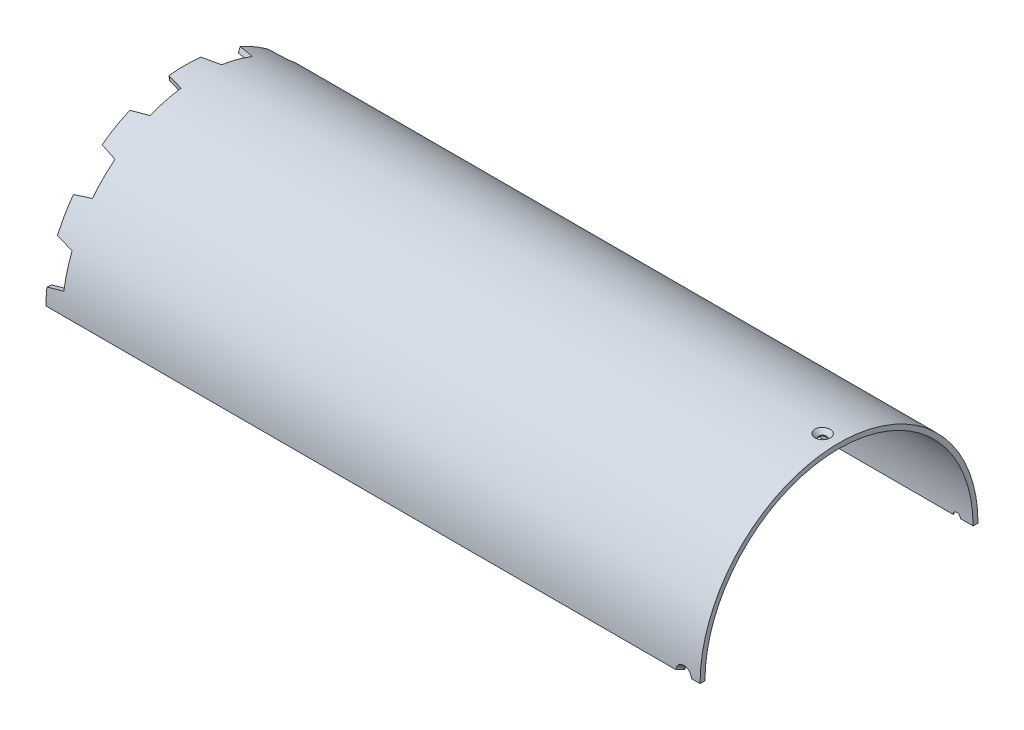
from build123d import *
from build123d.topology import SkipClean

# Parameters (mm, degrees)
SKETCH1_W                      = 390
SKETCH1_H                      = 3
BOSS_EXTRUDE1_DEPTH            = 5
DRAFT1_ANGLE                   = -15
CIRPATTERN1_COUNT              = 12
DRAFT1_OF_CIRPATTERN1_2_ANGLE  = -15
DRAFT1_OF_CIRPATTERN1_3_ANGLE  = -15
DRAFT1_OF_CIRPATTERN1_4_ANGLE  = -15
DRAFT1_OF_CIRPATTERN1_5_ANGLE  = -15
DRAFT1_OF_CIRPATTERN1_6_ANGLE  = -15
DRAFT1_OF_CIRPATTERN1_7_ANGLE  = -15
DRAFT1_OF_CIRPATTERN1_8_ANGLE  = -15
DRAFT1_OF_CIRPATTERN1_9_ANGLE  = -15
DRAFT1_OF_CIRPATTERN1_10_ANGLE = -15
DRAFT1_OF_CIRPATTERN1_11_ANGLE = -15
DRAFT1_OF_CIRPATTERN1_12_ANGLE = -15
SKETCH3_OUTSIDE_W              = 265.338
SKETCH3_OUTSIDE_H              = 265.338
CUT_EXTRUDE1_DEPTH             = 563.983125857


# Read off the part's stored shape, not the designer's step: CSK for M4 Countersunk Flat Head Screw1
with BuildPart() as part:
    # Sketch1 → Revolve1 (revolve)
    with BuildSketch(Plane.XY, mode=Mode.PRIVATE) as revolve1_sk:
        with Locations((355, 83.5)):
            Rectangle(SKETCH1_W, SKETCH1_H)
    revolve(revolve1_sk.sketch.rotate(Axis((0, 0, 0), (1, 0, 0)), 90), axis=Axis((0, 0, 0), (1, 0, 0)))

    # Sketch2 → Boss-Extrude1 (add, symmetric)
    with BuildSketch(Plane(origin=(155, 0, 0), x_dir=(0, 0, -1), z_dir=(1, 0, 0))):
        with BuildLine():
            Line((10.703147762, 81.298478633), (11.094726339, 84.272813217))
            ThreePointArc((11.094726339, 84.272813217), (0, 85), (-11.094726339, 84.272813217))
            Line((-11.094726339, 84.272813217), (-10.703147762, 81.298478633))
            ThreePointArc((-10.703147762, 81.298478633), (0, 82), (10.703147762, 81.298478633))
        make_face()
    boss_extrude1 = extrude(amount=BOSS_EXTRUDE1_DEPTH, both=True)

    # Draft1
    draft1_faces = [part.faces().sort_by_distance(p)[0] for p in [
        (155, 82.785645925, 10.89893705),
        (155, 82.785645925, -10.89893705),
    ]]
    draft(draft1_faces, Plane(origin=(155, 0, 0), x_dir=(0, 0, 1), z_dir=(1, 0, 0)), DRAFT1_ANGLE)

    # CirPattern1: Boss-Extrude1 ×12 about axis
    with SkipClean():  # the faces are left unmerged after this step: merging them gives an invalid solid
        cirpattern1_axis = Axis((0, 0, 0), (1, 0, 0))
        for i in range(1, CIRPATTERN1_COUNT):
            add(boss_extrude1.rotate(cirpattern1_axis, i * 360 / CIRPATTERN1_COUNT))

    # Draft1 of CirPattern1 2
    draft1_of_cirpattern1_2_faces = [part.faces().sort_by_distance(p)[0] for p in [
        (155, 66.245003914, 50.831579322),
        (155, 77.143940965, 31.954066602),
    ]]
    draft(draft1_of_cirpattern1_2_faces, Plane(origin=(155, 0, 0), x_dir=(0, -0.49999999999999994, 0.8660254037844387), z_dir=(1, 0, 0)), DRAFT1_OF_CIRPATTERN1_2_ANGLE)

    # Draft1 of CirPattern1 3
    draft1_of_cirpattern1_3_faces = [part.faces().sort_by_distance(p)[0] for p in [
        (155, 31.954066602, 77.143940965),
        (155, 50.831579322, 66.245003914),
    ]]
    draft(draft1_of_cirpattern1_3_faces, Plane(origin=(155, 0, 0), x_dir=(0, -0.8660254037844386, 0.5000000000000001), z_dir=(1, 0, 0)), DRAFT1_OF_CIRPATTERN1_3_ANGLE)

    # Draft1 of CirPattern1 4
    draft1_of_cirpattern1_4_faces = [part.faces().sort_by_distance(p)[0] for p in [
        (155, -10.89893705, 82.785645925),
        (155, 10.89893705, 82.785645925),
    ]]
    draft(draft1_of_cirpattern1_4_faces, Plane(origin=(155, 0, 0), x_dir=(0, -1, 0), z_dir=(1, 0, 0)), DRAFT1_OF_CIRPATTERN1_4_ANGLE)

    # Draft1 of CirPattern1 5
    draft1_of_cirpattern1_5_faces = [part.faces().sort_by_distance(p)[0] for p in [
        (155, -50.831579322, 66.245003914),
        (155, -31.954066602, 77.143940965),
    ]]
    draft(draft1_of_cirpattern1_5_faces, Plane(origin=(155, 0, 0), x_dir=(0, -0.8660254037844387, -0.4999999999999998), z_dir=(1, 0, 0)), DRAFT1_OF_CIRPATTERN1_5_ANGLE)

    # Draft1 of CirPattern1 6
    draft1_of_cirpattern1_6_faces = [part.faces().sort_by_distance(p)[0] for p in [
        (155, -77.143940965, 31.954066602),
        (155, -66.245003914, 50.831579322),
    ]]
    draft(draft1_of_cirpattern1_6_faces, Plane(origin=(155, 0, 0), x_dir=(0, -0.49999999999999994, -0.8660254037844387), z_dir=(1, 0, 0)), DRAFT1_OF_CIRPATTERN1_6_ANGLE)

    # Draft1 of CirPattern1 7
    draft1_of_cirpattern1_7_faces = [part.faces().sort_by_distance(p)[0] for p in [
        (155, -82.785645925, -10.89893705),
        (155, -82.785645925, 10.89893705),
    ]]
    draft(draft1_of_cirpattern1_7_faces, Plane(origin=(155, 0, 0), x_dir=(0, 0, -1), z_dir=(1, 0, 0)), DRAFT1_OF_CIRPATTERN1_7_ANGLE)

    # Draft1 of CirPattern1 8
    draft1_of_cirpattern1_8_faces = [part.faces().sort_by_distance(p)[0] for p in [
        (155, -66.245003914, -50.831579322),
        (155, -77.143940965, -31.954066602),
    ]]
    draft(draft1_of_cirpattern1_8_faces, Plane(origin=(155, 0, 0), x_dir=(0, 0.5000000000000001, -0.8660254037844386), z_dir=(1, 0, 0)), DRAFT1_OF_CIRPATTERN1_8_ANGLE)

    # Draft1 of CirPattern1 9
    draft1_of_cirpattern1_9_faces = [part.faces().sort_by_distance(p)[0] for p in [
        (155, -31.954066602, -77.143940965),
        (155, -50.831579322, -66.245003914),
    ]]
    draft(draft1_of_cirpattern1_9_faces, Plane(origin=(155, 0, 0), x_dir=(0, 0.8660254037844384, -0.5000000000000004), z_dir=(1, 0, 0)), DRAFT1_OF_CIRPATTERN1_9_ANGLE)

    # Draft1 of CirPattern1 10
    draft1_of_cirpattern1_10_faces = [part.faces().sort_by_distance(p)[0] for p in [
        (155, 10.89893705, -82.785645925),
        (155, -10.89893705, -82.785645925),
    ]]
    draft(draft1_of_cirpattern1_10_faces, Plane.YZ.offset(155), DRAFT1_OF_CIRPATTERN1_10_ANGLE)

    # Draft1 of CirPattern1 11
    draft1_of_cirpattern1_11_faces = [part.faces().sort_by_distance(p)[0] for p in [
        (155, 50.831579322, -66.245003914),
        (155, 31.954066602, -77.143940965),
    ]]
    draft(draft1_of_cirpattern1_11_faces, Plane(origin=(155, 0, 0), x_dir=(0, 0.8660254037844386, 0.5000000000000001), z_dir=(1, 0, 0)), DRAFT1_OF_CIRPATTERN1_11_ANGLE)

    # Draft1 of CirPattern1 12
    draft1_of_cirpattern1_12_faces = [part.faces().sort_by_distance(p)[0] for p in [
        (155, 77.143940965, -31.954066602),
        (155, 66.245003914, -50.831579322),
    ]]
    draft(draft1_of_cirpattern1_12_faces, Plane(origin=(155, 0, 0), x_dir=(0, 0.5000000000000004, 0.8660254037844384), z_dir=(1, 0, 0)), DRAFT1_OF_CIRPATTERN1_12_ANGLE)

    # Sketch3 outside → Cut-Extrude1 (cut, through all)
    with SkipClean():  # the faces are left unmerged after this step: merging them gives an invalid solid
        with BuildSketch(Plane(origin=(0, 0, 0), x_dir=(0, 0, -1), z_dir=(1, 0, 0))):
            Rectangle(SKETCH3_OUTSIDE_W, SKETCH3_OUTSIDE_H)
            with BuildLine():
                Line((0, 0), (-85, 0))
                ThreePointArc((-85, 0), (0, 85), (85, 0))
                Line((85, 0), (0, 0))
            make_face(mode=Mode.SUBTRACT)
        extrude(amount=CUT_EXTRUDE1_DEPTH, mode=Mode.SUBTRACT)

    # CSK for M4 Countersunk Flat Head Scr 2 → CSK for M4 Countersunk Flat Head Screw1 (revolve, cut)
    with SkipClean():  # the faces are left unmerged after this step: merging them gives an invalid solid
        with BuildSketch(Plane(origin=(540, 0, 0), x_dir=(1, 0, 0), z_dir=(0, 0, 1))):
            Polygon((4.700033545, 85.000033545), (0, 85.000033545), (0, 81.96910869), (2.25, 81.96910869), (2.25, 82.55), align=None)
        revolve(axis=Axis((540, 0, 0), (0, 1, 0)), mode=Mode.SUBTRACT)

    # CSK for M4 Countersunk Flat Head Scr 3 o → CSK for M4 Countersunk Flat Head Scr 3 (revolve, cut)
    with SkipClean():  # the faces are left unmerged after this step: merging them gives an invalid solid
        with BuildSketch(Plane(origin=(540, 0, 0), x_dir=(1, 0, 0), z_dir=(0, -1, 0))):
            Polygon((0, -85.000002015), (4.700002015, -85.000002015), (2.25, -82.55), (2.25, -81.969112603), (0, -81.969112603), align=None)
            Polygon((0, 81.969112603), (2.25, 81.969112603), (2.25, 82.55), (4.700002015, 85.000002015), (0, 85.000002015), align=None)
        revolve(axis=Axis((540, 0, 0), (0, 0, 1)), mode=Mode.SUBTRACT)


solid = part.part
